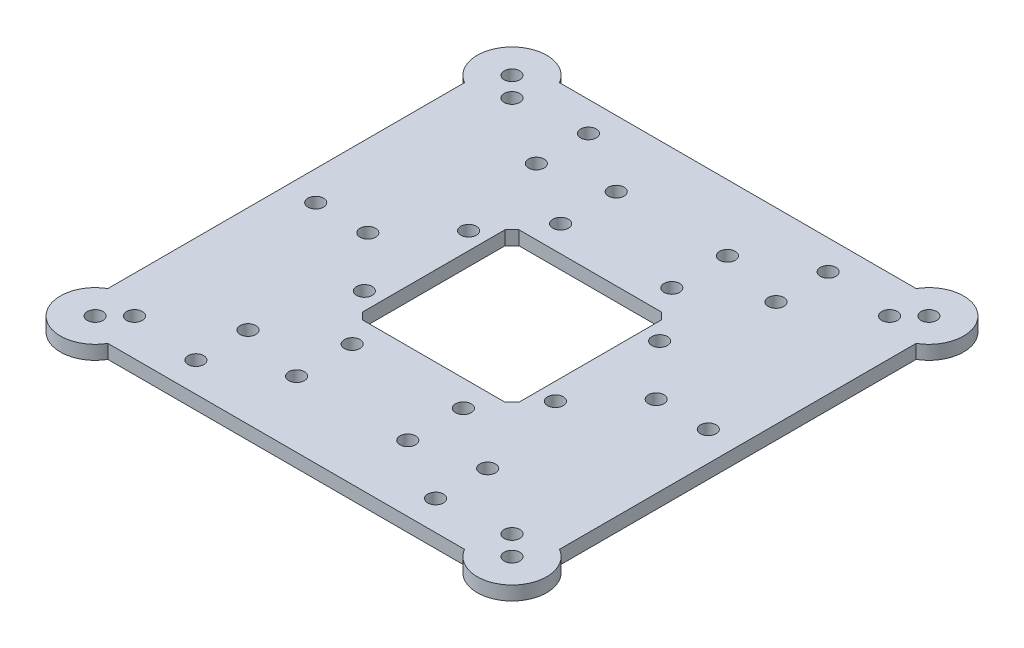
from build123d import *

# Parameters (mm, degrees)
SKETCH1_R          = 2.25
BASE_FLANGE1_DEPTH = 4
CUT_EXTRUDE1_REACH = 101.076
SKETCH5_R          = 2.25
CUT_EXTRUDE2_DEPTH = 100.075728612
SKETCH6_R          = 2.25
CUT_EXTRUDE3_DEPTH = 100.075728612
SKETCH8_W          = 5
SKETCH8_H          = 102.679491924
SKETCH8_W_2        = 102.679491924
SKETCH8_H_2        = 5
TAB1_DEPTH         = 4
SKETCH7_R          = 2.25
CUT_EXTRUDE4_DEPTH = 100.075728612
SKETCH9_R          = 2.25
CUT_EXTRUDE5_DEPTH = 100.075728612


# Sheet-metal steps are written as plain solids
with BuildPart() as part:
    # Sketch1 → Base-Flange1 (new body)
    with BuildSketch(Plane(origin=(0, 0, 0), x_dir=(1, 0, 0), z_dir=(0, 1, 0))):
        with BuildLine():
            Line((-60, 0), (-60, 42.679491924))
            ThreePointArc((-60, 42.679491924), (-61.339745962, 47.679491924), (-65, 51.339745962))
            ThreePointArc((-65, 51.339745962), (-67.071067812, 67.071067812), (-51.339745962, 65))
            ThreePointArc((-51.339745962, 65), (-47.679491924, 61.339745962), (-42.679491924, 60))
            Line((-42.679491924, 60), (0, 60))
            Line((0, 60), (42.679491924, 60))
            ThreePointArc((42.679491924, 60), (47.679491924, 61.339745962), (51.339745962, 65))
            ThreePointArc((51.339745962, 65), (67.071067812, 67.071067812), (65, 51.339745962))
            ThreePointArc((65, 51.339745962), (61.339745962, 47.679491924), (60, 42.679491924))
            Line((60, 42.679491924), (60, 0))
            Line((60, 0), (60, -42.679491924))
            ThreePointArc((60, -42.679491924), (61.339745962, -47.679491924), (65, -51.339745962))
            ThreePointArc((65, -51.339745962), (67.071067812, -67.071067812), (51.339745962, -65))
            ThreePointArc((51.339745962, -65), (47.679491924, -61.339745962), (42.679491924, -60))
            Line((42.679491924, -60), (0, -60))
            Line((0, -60), (-42.679491924, -60))
            ThreePointArc((-42.679491924, -60), (-47.679491924, -61.339745962), (-51.339745962, -65))
            ThreePointArc((-51.339745962, -65), (-67.071067812, -67.071067812), (-65, -51.339745962))
            ThreePointArc((-65, -51.339745962), (-61.339745962, -47.679491924), (-60, -42.679491924))
            Line((-60, -42.679491924), (-60, 0))
        make_face()
        with Locations(Location((-60, 60, 0), (0, 0, 270))):
            Circle(SKETCH1_R, mode=Mode.SUBTRACT)
        with Locations(Location((60, 60, 0), (0, 0, 270))):
            Circle(SKETCH1_R, mode=Mode.SUBTRACT)
        with Locations(Location((60, -60, 0), (0, 0, 270))):
            Circle(SKETCH1_R, mode=Mode.SUBTRACT)
        with Locations(Location((-60, -60, 0), (0, 0, 270))):
            Circle(SKETCH1_R, mode=Mode.SUBTRACT)
    extrude(amount=-BASE_FLANGE1_DEPTH)

    # Sketch4 → Cut-Extrude1 (cut, up to next)
    with BuildSketch(Plane(origin=(0, 0, 0), x_dir=(1, 0, 0), z_dir=(0, 1, 0)), mode=Mode.PRIVATE) as cut_extrude1_sk1:
        Polygon((-20.5, 22.5), (20.5, 22.5), (22.5, 20.5), (22.5, -20.5), (20.5, -22.5), (-20.5, -22.5), (-22.5, -20.5), (-22.5, 20.5), align=None)
    cut_extrude1_tool1 = extrude(cut_extrude1_sk1.sketch, amount=-CUT_EXTRUDE1_REACH, mode=Mode.PRIVATE) & part.part
    add(cut_extrude1_tool1.solids().sort_by_distance((0, 0, 0))[0], mode=Mode.SUBTRACT)

    # Sketch5 → Cut-Extrude2 (cut, through all)
    with BuildSketch(Plane.XZ.offset(4)):
        with Locations(Location((-54.343145751, 54.343145751, 0), (0, 0, 270))):
            Circle(SKETCH5_R)
        with Locations(Location((54.343145751, 54.343145751, 0), (0, 0, 270))):
            Circle(SKETCH5_R)
        with Locations(Location((54.343145751, -54.343145751, 0), (0, 0, 270))):
            Circle(SKETCH5_R)
        with Locations(Location((-54.343145751, -54.343145751, 0), (0, 0, 270))):
            Circle(SKETCH5_R)
    extrude(amount=-CUT_EXTRUDE2_DEPTH, mode=Mode.SUBTRACT)

    # Sketch6 → Cut-Extrude3 (cut, through all)
    with BuildSketch(Plane.XZ.offset(4)):
        with Locations(Location((27.5, 15, 0), (0, 0, 270))):
            Circle(SKETCH6_R)
        with Locations(Location((27.5, -15, 0), (0, 0, 270))):
            Circle(SKETCH6_R)
        with Locations(Location((-27.5, -15, 0), (0, 0, 270))):
            Circle(SKETCH6_R)
        with Locations(Location((-27.5, 15, 0), (0, 0, 270))):
            Circle(SKETCH6_R)
    extrude(amount=-CUT_EXTRUDE3_DEPTH, mode=Mode.SUBTRACT)

    # Sketch8 → Tab1 (add)
    with BuildSketch(Plane.XZ.offset(4)):
        with Locations((-62.5, 0)):
            Rectangle(SKETCH8_W, SKETCH8_H)
        with Locations((0, -62.5)):
            Rectangle(SKETCH8_W_2, SKETCH8_H_2)
        with Locations((62.5, 0)):
            Rectangle(SKETCH8_W, SKETCH8_H)
        with Locations((0, 62.5)):
            Rectangle(SKETCH8_W_2, SKETCH8_H_2)
    extrude(amount=-TAB1_DEPTH)

    # Sketch7 → Cut-Extrude4 (cut, through all)
    with BuildSketch(Plane.XZ.offset(4)):
        with Locations(Location((-16, 46, 0), (0, 0, 270))):
            Circle(SKETCH7_R)
        with Locations(Location((-16, 30, 0), (0, 0, 270))):
            Circle(SKETCH7_R)
        with Locations(Location((16, 30, 0), (0, 0, 90))):
            Circle(SKETCH7_R)
        with Locations(Location((16, 46, 0), (0, 0, 90))):
            Circle(SKETCH7_R)
        with Locations(Location((16, -46, 0), (0, 0, 270))):
            Circle(SKETCH7_R)
        with Locations(Location((16, -30, 0), (0, 0, 270))):
            Circle(SKETCH7_R)
        with Locations(Location((-16, -30, 0), (0, 0, 90))):
            Circle(SKETCH7_R)
        with Locations(Location((-16, -46, 0), (0, 0, 90))):
            Circle(SKETCH7_R)
    extrude(amount=-CUT_EXTRUDE4_DEPTH, mode=Mode.SUBTRACT)

    # Sketch9 → Cut-Extrude5 (cut, through all)
    with BuildSketch(Plane.XZ.offset(4)):
        with Locations(Location((-34.5, 56.5, 0), (0, 0, 270))):
            Circle(SKETCH9_R)
        with Locations(Location((-34.5, 41.5, 0), (0, 0, 270))):
            Circle(SKETCH9_R)
        with Locations(Location((-56.5, 0, 0), (0, 0, 270))):
            Circle(SKETCH9_R)
        with Locations(Location((-41.5, 0, 0), (0, 0, 270))):
            Circle(SKETCH9_R)
        with Locations(Location((-34.5, -41.5, 0), (0, 0, 270))):
            Circle(SKETCH9_R)
        with Locations(Location((-34.5, -56.5, 0), (0, 0, 270))):
            Circle(SKETCH9_R)
        with Locations(Location((34.5, -56.5, 0), (0, 0, 90))):
            Circle(SKETCH9_R)
        with Locations(Location((34.5, -41.5, 0), (0, 0, 90))):
            Circle(SKETCH9_R)
        with Locations(Location((41.5, 0, 0), (0, 0, 90))):
            Circle(SKETCH9_R)
        with Locations(Location((56.5, 0, 0), (0, 0, 90))):
            Circle(SKETCH9_R)
        with Locations(Location((34.5, 41.5, 0), (0, 0, 90))):
            Circle(SKETCH9_R)
        with Locations(Location((34.5, 56.5, 0), (0, 0, 90))):
            Circle(SKETCH9_R)
    extrude(amount=-CUT_EXTRUDE5_DEPTH, mode=Mode.SUBTRACT)


solid = part.part
